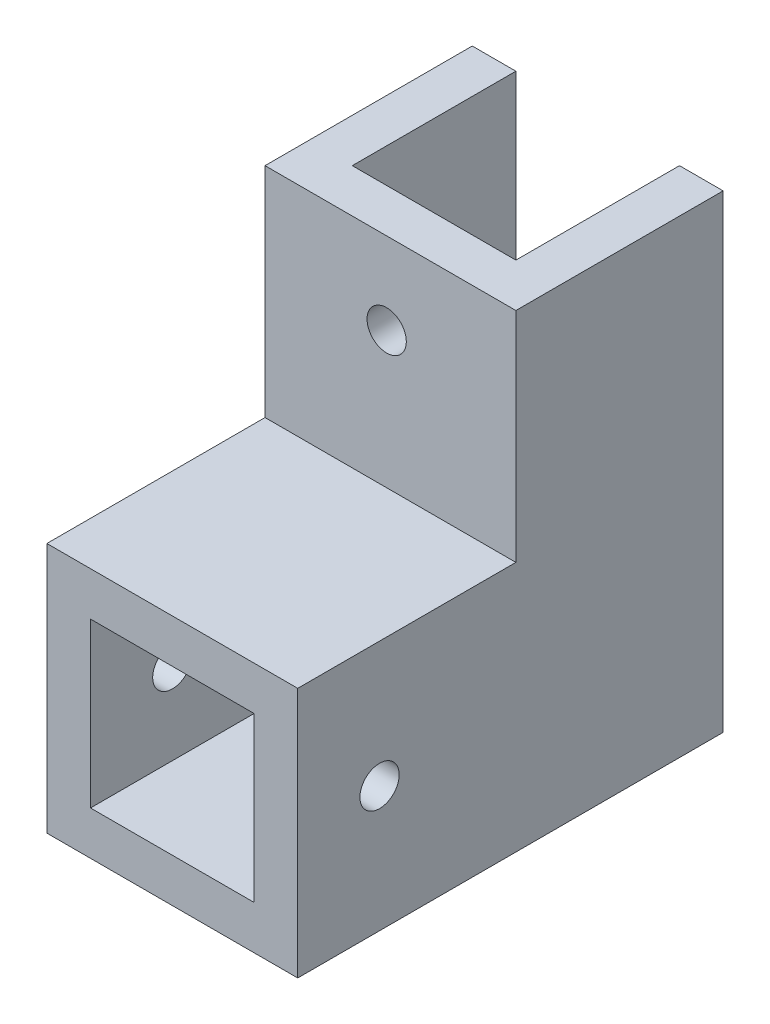
from build123d import *

# Parameters (mm, degrees)
EXTRUDE_1_DEPTH     = 20
SKETCH_2_W          = 23
SKETCH_2_H          = 23
SKETCH_2_W_2        = 15
SKETCH_2_H_2        = 15
EXTRUDE_2_DEPTH     = 24
SKETCH_3_W          = 4
SKETCH_3_H          = 23
EXTRUDE_3_DEPTH     = 15
SKETCH_4_R          = 1.8
CUT_EXTRUDE_1_DEPTH = 15
SKETCH_5_R          = 1.8
CUT_EXTRUDE_2_DEPTH = 35


with BuildPart() as part:
    # 草图1 → 凸台-拉伸1 (new body)
    with BuildSketch(Plane(origin=(0, 0, 0), x_dir=(1, 0, 0), z_dir=(0, 1, 0))):
        Polygon((-11.153846154, 14.269230769), (-7.153846154, 14.269230769), (-7.153846154, -0.730769231), (7.846153846, -0.730769231), (7.846153846, 14.269230769), (11.846153846, 14.269230769), (11.846153846, -0.730769231), (11.846153846, -4.730769231), (-7.384615385, -4.730769231), (-11.153846154, -4.730769231), align=None)
    extrude(amount=EXTRUDE_1_DEPTH)

    # 草图2 → 凸台-拉伸2 (add)
    with BuildSketch(Plane(origin=(0, 0, 0.730769231), x_dir=(-1, 0, 0), z_dir=(0, 0, -1))):
        with Locations((-0.346153846, -11.5)):
            Rectangle(SKETCH_2_W, SKETCH_2_H)
        with Locations((-0.346153846, -11.5)):
            Rectangle(SKETCH_2_W_2, SKETCH_2_H_2, mode=Mode.SUBTRACT)
    extrude(amount=-EXTRUDE_2_DEPTH)

    # 草图3 → 凸台-拉伸3 (add)
    with BuildSketch(Plane(origin=(0, 0, 0.730769231), x_dir=(-1, 0, 0), z_dir=(0, 0, -1))):
        with Locations((-9.846153846, -11.5)):
            Rectangle(SKETCH_3_W, SKETCH_3_H)
        with Locations((9.153846154, -11.5)):
            Rectangle(SKETCH_3_W, SKETCH_3_H)
    extrude(amount=EXTRUDE_3_DEPTH)

    # 草图4 → 切除-拉伸1 (cut)
    with BuildSketch(Plane.XY.offset(4.730769231)):
        with Locations((0, 12.5)):
            Circle(SKETCH_4_R)
    extrude(amount=-CUT_EXTRUDE_1_DEPTH, mode=Mode.SUBTRACT)

    # 草图5 → 切除-拉伸2 (cut)
    with BuildSketch(Plane(origin=(11.846153846, 0, 0), x_dir=(0, 0, -1), z_dir=(1, 0, 0))):
        with Locations((-17.230769231, -11.5)):
            Circle(SKETCH_5_R)
    extrude(amount=-CUT_EXTRUDE_2_DEPTH, mode=Mode.SUBTRACT)


solid = part.part
